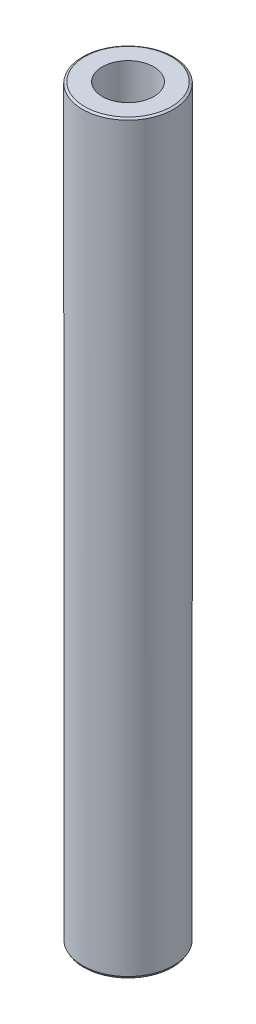
from build123d import *
from OCP.BRepFilletAPI import BRepFilletAPI_MakeChamfer

# Parameters (mm, degrees)
SKETCH1_R           = 35
BOSS_EXTRUDE1_DEPTH = 573.342076472
SKETCH2_R           = 19.836097689
CUT_EXTRUDE1_DEPTH  = 576.474705485
CHAMFER1_SIZE       = 0.956176014
CHAMFER1_SIZE2      = 1.656145438


with BuildPart() as part:
    # Sketch1 → Boss-Extrude1 (new body)
    with BuildSketch(Plane(origin=(0, 0, 0), x_dir=(1, 0, 0), z_dir=(0, 1, 0))):
        Circle(SKETCH1_R)
    extrude(amount=BOSS_EXTRUDE1_DEPTH)

    # Sketch2 → Cut-Extrude1 (cut, through all)
    with BuildSketch(Plane(origin=(0, 0, 0), x_dir=(1, 0, 0), z_dir=(0, 1, 0))):
        Circle(SKETCH2_R)
    extrude(amount=CUT_EXTRUDE1_DEPTH, mode=Mode.SUBTRACT)

    # Chamfer1: one chamfer whose edges measure the first distance from different faces: ONE call of the kernel's chamfer builder (chamfer() names one face for all edges)
    chamfer1_edges_1 = [part.edges().sort_by_distance(p)[0] for p in [
        (-35, 573.342076472, 0),
    ]]
    chamfer1_side_1 = [part.faces().sort_by_distance(p)[0] for p in [
        (-35, 286.671038236, 0),
    ]]
    chamfer1_edges_2 = [part.edges().sort_by_distance(p)[0] for p in [
        (-35, 0, 0),
    ]]
    chamfer1_side_2 = [part.faces().sort_by_distance(p)[0] for p in [
        (-34.010050506, 0, 0),
    ]]
    chamfer1 = BRepFilletAPI_MakeChamfer(part.part.solid().wrapped)
    for e in chamfer1_edges_1:
        chamfer1.Add(CHAMFER1_SIZE, CHAMFER1_SIZE2, e.wrapped, chamfer1_side_1[0].wrapped)  # the first distance lies on this face
    for e in chamfer1_edges_2:
        chamfer1.Add(CHAMFER1_SIZE, CHAMFER1_SIZE2, e.wrapped, chamfer1_side_2[0].wrapped)  # the first distance lies on this face
    add(Compound.cast(chamfer1.Shape()), mode=Mode.REPLACE)


solid = part.part
